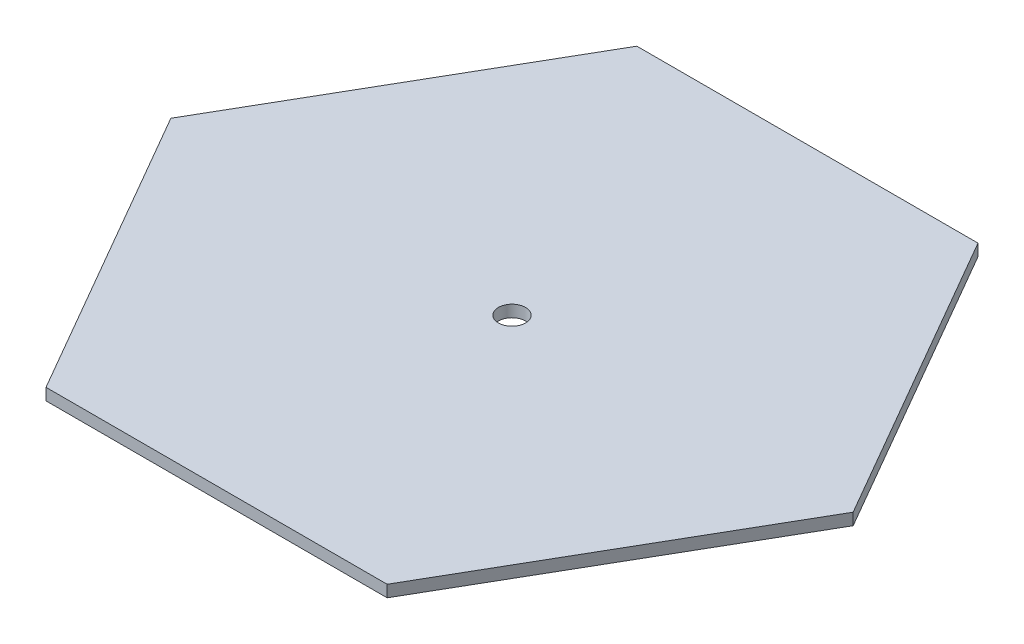
from build123d import *

# Parameters (mm, degrees)
BOSS_EXTRUDE1_DEPTH = 5
SKETCH5_R           = 5.753179175
CUT_EXTRUDE1_DEPTH  = 192.882125275


with BuildPart() as part:
    # Sketch1 → Boss-Extrude1 (new body)
    with BuildSketch(Plane(origin=(0, 0, 0), x_dir=(1, 0, 0), z_dir=(0, 1, 0))):
        Polygon((72.5, 125.573683549), (-72.5, 125.573683549), (-145, 0), (-72.5, -125.573683549), (72.5, -125.573683549), (145, 0), align=None)
    extrude(amount=BOSS_EXTRUDE1_DEPTH)

    # Sketch5 → Cut-Extrude1 (cut, through all)
    with BuildSketch(Plane(origin=(0, 5, 0), x_dir=(1, 0, 0), z_dir=(0, 1, 0))):
        Circle(SKETCH5_R)
    extrude(amount=-CUT_EXTRUDE1_DEPTH, mode=Mode.SUBTRACT)


solid = part.part
